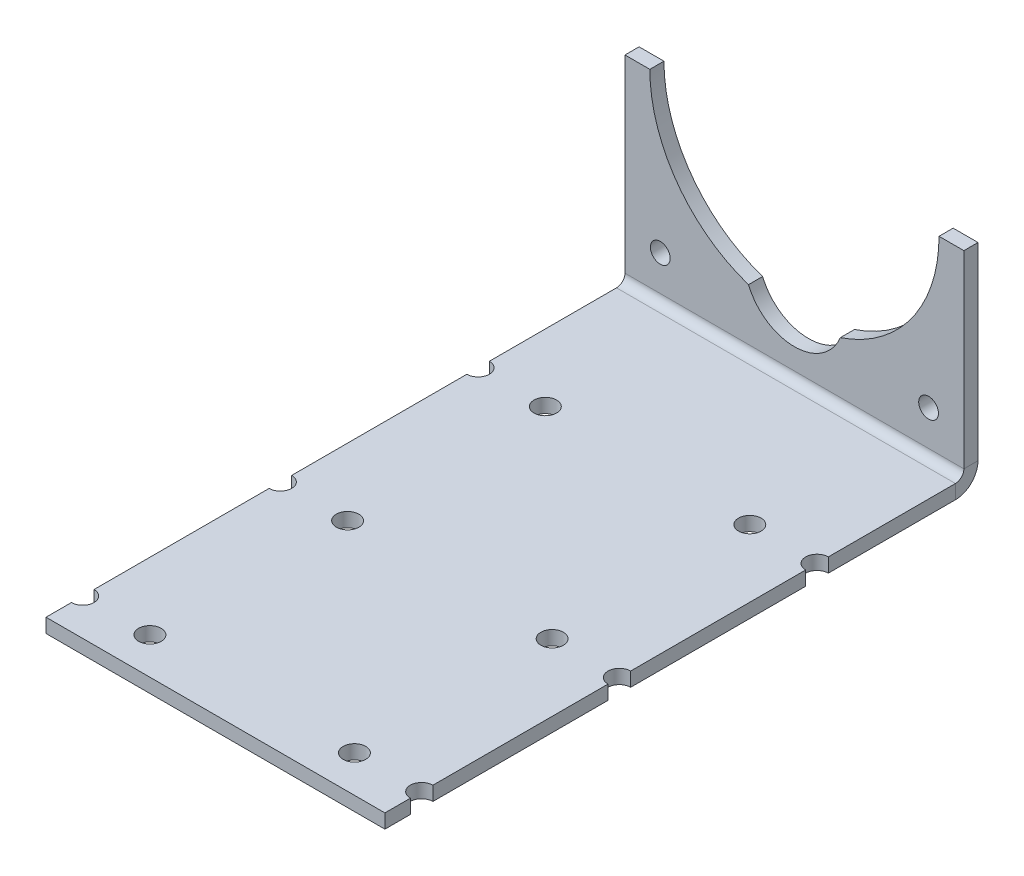
from build123d import *

# Parameters (mm, degrees)
BASE_FLANGE2_DEPTH           = 5
EDGE_FLANGE3_STRIP_W         = 26
EDGE_FLANGE3_STRIP_H         = 5
EDGE_FLANGE3_STRIP_CUT_DEPTH = 120
EDGE_FLANGE3_DEPTH           = 120
SKETCH18_R                   = 3
CUT_EXTRUDE7_DEPTH           = 10
SKETCH22_R                   = 4
CUT_EXTRUDE11_DEPTH          = 10
SKETCH25_R                   = 3.5
CUT_EXTRUDE14_DEPTH          = 10
CUT_EXTRUDE17_DEPTH          = 243.986110714
CUT_EXTRUDE17_DEPTH_BACK     = 243.986110714
SKETCH26_R                   = 3


# Sheet-metal steps are written as plain solids
with BuildPart() as part:
    # Sketch1 → Base-Flange2 (new body)
    with BuildSketch(Plane.XY):
        with BuildLine():
            Line((60, -19.74), (60, 100.5))
            ThreePointArc((60, 100.5), (58.242640687, 104.742640687), (54, 106.5))
            Line((54, 106.5), (-54, 106.5))
            ThreePointArc((-54, 106.5), (-58.242640687, 104.742640687), (-60, 100.5))
            Line((-60, 100.5), (-60, -19.74))
            Line((-60, -19.74), (60, -19.74))
        make_face()
    extrude(amount=BASE_FLANGE2_DEPTH)

    # Edge-Flange3 strip (across the edge) → Edge-Flange3 strip cut (cut)
    with BuildSketch(Plane(origin=(-60, -19.74, 5), x_dir=(0, 1, 0), z_dir=(1, 0, 0))):
        with Locations((-10, -2.5)):
            Rectangle(EDGE_FLANGE3_STRIP_W, EDGE_FLANGE3_STRIP_H)
    extrude(amount=EDGE_FLANGE3_STRIP_CUT_DEPTH, mode=Mode.SUBTRACT)

    # Edge-Flange3 section (across the edge) → Edge-Flange3 (add)
    with BuildSketch(Plane(origin=(-60, -19.74, 5), x_dir=(0, 1, 0), z_dir=(1, 0, 0))):
        with BuildLine():
            Line((-5, 3), (-5, 205))
            Line((-5, 205), (0, 205))
            Line((0, 205), (0, 3))
            ThreePointArc((0, 3), (0.878679656, 0.878679656), (3, 0))
            Line((3, 0), (3, -5))
            ThreePointArc((3, -5), (-2.656854249, -2.656854249), (-5, 3))
        make_face()
    extrude(amount=EDGE_FLANGE3_DEPTH)

    # Sketch18 → Cut-Extrude7 (cut)
    with BuildSketch(Plane.XY.offset(5)):
        with Locations((-50, 96.5)):
            Circle(SKETCH18_R)
        with Locations((50, 96.5)):
            Circle(SKETCH18_R)
    extrude(amount=-CUT_EXTRUDE7_DEPTH, mode=Mode.SUBTRACT)

    # Sketch22 → Cut-Extrude11 (cut)
    with BuildSketch(Plane(origin=(0, -19.74, 0), x_dir=(1, 0, 0), z_dir=(0, 1, 0))):
        with Locations(Location((36.205, -197, 0), (0, 0, 270))):
            Circle(SKETCH22_R)
        with Locations(Location((-36.205, -197, 0), (0, 0, 270))):
            Circle(SKETCH22_R)
        with Locations(Location((-36.205, -127, 0), (0, 0, 270))):
            Circle(SKETCH22_R)
        with Locations(Location((36.205, -127, 0), (0, 0, 270))):
            Circle(SKETCH22_R)
        with Locations(Location((36.205, -57, 0), (0, 0, 270))):
            Circle(SKETCH22_R)
        with Locations(Location((-36.205, -57, 0), (0, 0, 270))):
            Circle(SKETCH22_R)
        with Locations((60, -197)):
            Circle(SKETCH22_R)
        with Locations((60, -127)):
            Circle(SKETCH22_R)
        with Locations((-60, -197)):
            Circle(SKETCH22_R)
        with Locations((-60, -127)):
            Circle(SKETCH22_R)
        with Locations((-60, -57)):
            Circle(SKETCH22_R)
        with Locations((60, -57)):
            Circle(SKETCH22_R)
    extrude(amount=-CUT_EXTRUDE11_DEPTH, mode=Mode.SUBTRACT)

    # Sketch25 → Cut-Extrude14 (cut)
    with BuildSketch(Plane(origin=(0, 0, 0), x_dir=(-1, 0, 0), z_dir=(0, 0, -1))):
        with Locations((-47.5, -4.24)):
            Circle(SKETCH25_R)
        with Locations((47.5, -4.24)):
            Circle(SKETCH25_R)
        with BuildLine():
            ThreePointArc((16.25584062, 1.619123121), (0, 101.37), (-16.25584062, 1.619123121))
            ThreePointArc((-16.25584062, 1.619123121), (0, -9.3), (16.25584062, 1.619123121))
        make_face()
    extrude(amount=-CUT_EXTRUDE14_DEPTH, mode=Mode.SUBTRACT)

    # Sketch26 → Cut-Extrude17 (cut, two sides: drawn at the far end of the back side and taken through both)
    with BuildSketch(Plane(origin=(0, 0, 0), x_dir=(-1, 0, 0), z_dir=(0, 0, -1)).offset(-CUT_EXTRUDE17_DEPTH_BACK)):
        with BuildLine():
            Line((-60, 50.17), (-51.2, 50.17))
            ThreePointArc((-51.2, 50.17), (0, 101.37), (51.2, 50.17))
            Line((51.2, 50.17), (60, 50.17))
            Line((60, 50.17), (60, 100.5))
            ThreePointArc((60, 100.5), (58.242640687, 104.742640687), (54, 106.5))
            Line((54, 106.5), (-54, 106.5))
            ThreePointArc((-54, 106.5), (-58.242640687, 104.742640687), (-60, 100.5))
            Line((-60, 100.5), (-60, 50.17))
        make_face()
        with Locations((-50, 96.5)):
            Circle(SKETCH26_R, mode=Mode.SUBTRACT)
        with Locations((50, 96.5)):
            Circle(SKETCH26_R, mode=Mode.SUBTRACT)
    extrude(amount=CUT_EXTRUDE17_DEPTH + CUT_EXTRUDE17_DEPTH_BACK, mode=Mode.SUBTRACT)


solid = part.part
